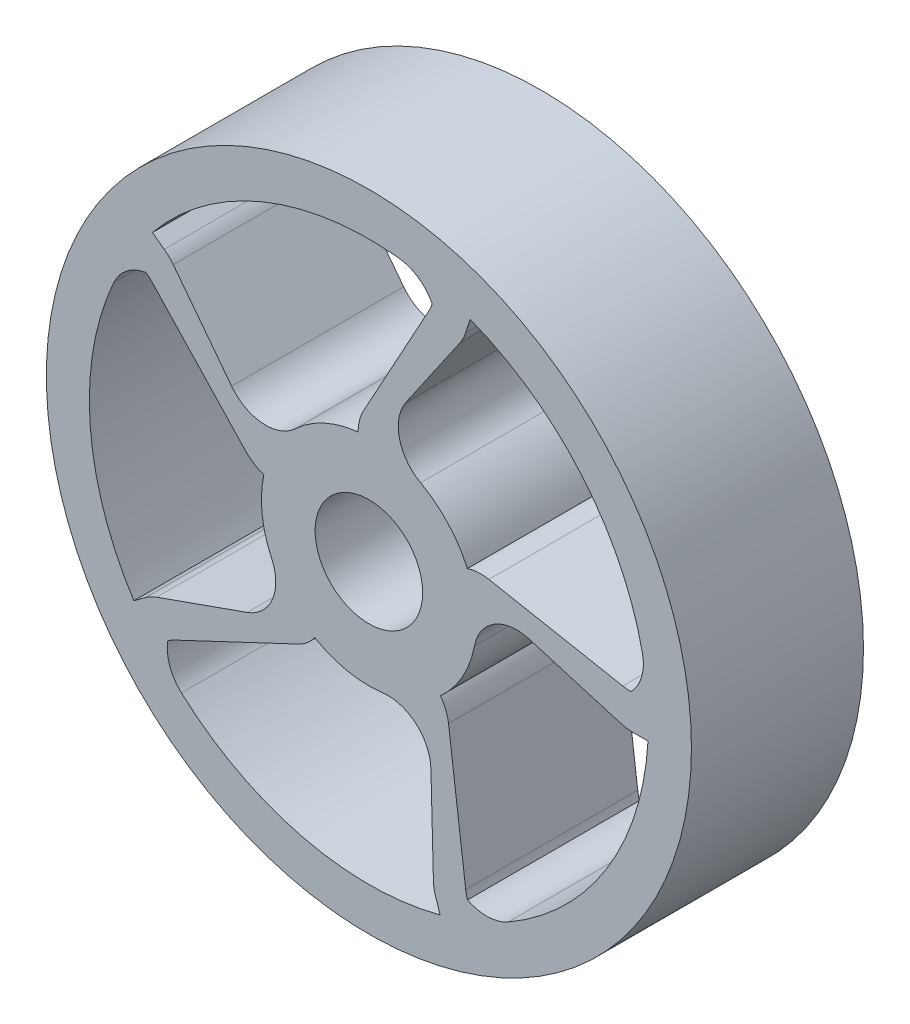
from build123d import *

# Parameters (mm, degrees)
SKETCH1_R           = 150
BOSS_EXTRUDE1_DEPTH = 80
BOSS_EXTRUDE2_DEPTH = 80
LOFT1_DEPTH         = 80
CIRPATTERN1_COUNT   = 5
FILLET1_R           = 20
FILLET2_R           = 20
FILLET3_R           = 20
SKETCH3_R           = 25
CUT_EXTRUDE1_DEPTH  = 80


with BuildPart() as part:
    # Sketch1 → Boss-Extrude1 (new body)
    with BuildSketch(Plane.XY):
        Circle(SKETCH1_R)
        with BuildLine():
            Line((129.710171657, 8.675907367), (119.956691368, 8.625091073))
            Line((119.956691368, 8.625091073), (120.040051321, -7.374691773))
            Line((120.040051321, -7.374691773), (129.793531611, -7.323875479))
            ThreePointArc((129.793531611, -7.323875479), (105.568888587, -75.86309882), (48.333925621, -120.680701166))
            Line((48.333925621, -120.680701166), (45.271605291, -111.420293279))
            Line((45.271605291, -111.420293279), (30.080667198, -116.443778112))
            Line((30.080667198, -116.443778112), (33.142987529, -125.704185999))
            ThreePointArc((33.142987529, -125.704185999), (-39.527513828, -123.84496619), (-99.838162814, -83.260682474))
            Line((-99.838162814, -83.260682474), (-91.977300573, -77.486619356))
            Line((-91.977300573, -77.486619356), (-101.449176589, -64.591520879))
            Line((-101.449176589, -64.591520879), (-109.310038829, -70.365583996))
            ThreePointArc((-109.310038829, -70.365583996), (-129.998235624, -0.677299621), (-110.037303615, 69.222769471))
            Line((-110.037303615, 69.222769471), (-102.116703238, 63.530928844))
            Line((-102.116703238, 63.530928844), (-92.779706461, 76.524022824))
            Line((-92.779706461, 76.524022824), (-100.700306837, 82.215863451))
            ThreePointArc((-100.700306837, 82.215863451), (-40.815814265, 123.426372003), (31.831369149, 126.042706802))
            Line((31.831369149, 126.042706802), (28.865707153, 116.750892719))
            Line((28.865707153, 116.750892719), (44.10816453, 111.88596794))
            Line((44.10816453, 111.88596794), (47.073826527, 121.177782024))
            ThreePointArc((47.073826527, 121.177782024), (104.772675129, 76.958992627), (129.710171657, 8.675907367))
        make_face(mode=Mode.SUBTRACT)
    extrude(amount=BOSS_EXTRUDE1_DEPTH)


with BuildPart() as body_2:
    # Sketch2 → Boss-Extrude2 (new body)
    with BuildSketch(Plane.XY):
        with BuildLine():
            Line((-5, 55), (5, 55))
            Line((5, 55), (5, 49.749371855))
            ThreePointArc((5, 49.749371855), (29.389262615, 40.450849719), (45.769379313, 20.128683944))
            Line((45.769379313, 20.128683944), (50.763023424, 21.751217272))
            Line((50.763023424, 21.751217272), (53.853193368, 12.240652109))
            Line((53.853193368, 12.240652109), (48.859549256, 10.618118781))
            ThreePointArc((48.859549256, 10.618118781), (47.552825815, -15.450849719), (33.287032059, -37.309161029))
            Line((33.287032059, -37.309161029), (36.373273848, -41.557008429))
            Line((36.373273848, -41.557008429), (28.283103904, -47.434860952))
            Line((28.283103904, -47.434860952), (25.196862116, -43.187013552))
            ThreePointArc((25.196862116, -43.187013552), (0, -50), (-25.196862116, -43.187013552))
            Line((-25.196862116, -43.187013552), (-28.283103904, -47.434860952))
            Line((-28.283103904, -47.434860952), (-36.373273848, -41.557008429))
            Line((-36.373273848, -41.557008429), (-33.287032059, -37.309161029))
            ThreePointArc((-33.287032059, -37.309161029), (-47.552825815, -15.450849719), (-48.859549256, 10.618118781))
            Line((-48.859549256, 10.618118781), (-53.853193368, 12.240652109))
            Line((-53.853193368, 12.240652109), (-50.763023424, 21.751217272))
            Line((-50.763023424, 21.751217272), (-45.769379313, 20.128683944))
            ThreePointArc((-45.769379313, 20.128683944), (-29.389262615, 40.450849719), (-5, 49.749371855))
            Line((-5, 49.749371855), (-5, 55))
        make_face()
    extrude(amount=BOSS_EXTRUDE2_DEPTH)


with BuildPart() as body_3:
    # Loft1: read off the stored shape, not the designer's step
    # Loft1 outline → Loft1 (new body)
    with BuildSketch(Plane.XY):
        Polygon((44.10816453, 111.88596794), (28.865707153, 116.750892719), (-5, 55), (5, 55), align=None)
    extrude(amount=LOFT1_DEPTH)


with BuildPart() as cirpattern1_1:
    # CirPattern1: pattern copy
    add(body_3.part.rotate(Axis((0, 0, 0), (0, 0, 1)), 1 * 360 / CIRPATTERN1_COUNT))


with BuildPart() as cirpattern1_2:
    # CirPattern1: pattern copy
    add(body_3.part.rotate(Axis((0, 0, 0), (0, 0, 1)), 2 * 360 / CIRPATTERN1_COUNT))


with BuildPart() as cirpattern1_3:
    # CirPattern1: pattern copy
    add(body_3.part.rotate(Axis((0, 0, 0), (0, 0, 1)), 3 * 360 / CIRPATTERN1_COUNT))


with BuildPart() as cirpattern1_4:
    # CirPattern1: pattern copy
    add(body_3.part.rotate(Axis((0, 0, 0), (0, 0, 1)), 4 * 360 / CIRPATTERN1_COUNT))

    # Combine1: union body 2, part, body 3, CirPattern1_1, CirPattern1_2, CirPattern1_3
    add(body_2.part)
    add(part.part)
    add(body_3.part)
    add(cirpattern1_1.part)
    add(cirpattern1_2.part)
    add(cirpattern1_3.part)

    # Fillet1
    # the kernel refuses this fillet: 20 mm, written as the material it adds along each edge
    with BuildSketch(Plane(origin=(-91.977300573, -77.486619356, 0), x_dir=(-0.8059436548419507, -0.5919922509796886, 0), z_dir=(0, 0, 1)), Plane(origin=(45.271605291, -111.420293279, 0), x_dir=(0.31396780203564834, -0.9494336307951725, 0), z_dir=(0, 0, 1)), Plane(origin=(-102.116703238, 63.530928844, 0), x_dir=(-0.8120683737452884, 0.5835622986131666, 0), z_dir=(0, 0, 1))) as fillet1_piece_1:
        with BuildLine():
            CenterArc((FILLET1_R * 0.0966409957188, FILLET1_R), FILLET1_R, 258.96004162, 11.03995838)
            Line((-FILLET1_R * 0.0948525451909, FILLET1_R * 0.0185061264634), (0, 0))
            Line((0, 0), (FILLET1_R * 0.0966409957188, 0))
        make_face()
    extrude(amount=80)
    with BuildSketch(Plane(origin=(119.956691369, 8.625091073, 0), x_dir=(-0.9824782333673042, 0.1863773617139722, 0), z_dir=(0, 0, 1))) as fillet1_piece_2:
        with BuildLine():
            CenterArc((FILLET1_R * 0.0966409957054, -FILLET1_R), FILLET1_R, 90, 11.03995838)
            Line((-FILLET1_R * 0.0948525452044, -FILLET1_R * 0.0185061264634), (0, 0))
            Line((0, 0), (FILLET1_R * 0.0966409957054, 0))
        make_face()
    extrude(amount=80)
    with BuildSketch(Plane(origin=(28.865707153, 116.750892719, 0), x_dir=(-0.4808578750966385, -0.8767985538067142, 0), z_dir=(0, 0, 1))) as fillet1_piece_3:
        with BuildLine():
            CenterArc((FILLET1_R * 0.0966409957188, -FILLET1_R), FILLET1_R, 90.000000002, 11.03995838)
            Line((-FILLET1_R * 0.0948525452298, -FILLET1_R * 0.018506126471), (0, 0))
            Line((0, 0), (FILLET1_R * 0.0966409956792, 0))
        make_face()
    extrude(amount=80)
    with BuildSketch(Plane(origin=(-36.373273848, -41.557008429, 0), x_dir=(-0.9426873980194184, -0.33367719372977617, 0), z_dir=(0, 0, 1)), Plane(origin=(28.283103904, -47.434860952, 0), x_dir=(0.026039443064681988, -0.9996609162135335, 0), z_dir=(0, 0, 1)), Plane(origin=(53.853193368, 12.240652109, 0), x_dir=(0.9587806588816111, -0.28414722971470946, 0), z_dir=(0, 0, 1)), Plane(origin=(5, 55, 0), x_dir=(0.5665195918801321, 0.8240482704404934, 0), z_dir=(0, 0, 1)), Plane(origin=(-50.763023424, 21.751217272, 0), x_dir=(-0.6086522958068845, 0.7934370692178484, 0), z_dir=(0, 0, 1))) as fillet1_piece_4:
        with BuildLine():
            CenterArc((6.167760881, -20), FILLET1_R, 90, 31.649839664)
            Line((-4.326771041, -2.974583714), (0, 0))
            Line((0, 0), (6.167760881, 0))
        make_face()
    extrude(amount=80)
    # the kernel refuses this fillet: 20 mm, written as the material it takes off along each edge
    with BuildSketch(Plane(origin=(-101.449176589, -64.591520879, -7.386208111), x_dir=(0.9426873980435565, 0.33367719366158266, 0), z_dir=(0, 0, 1)), Plane(origin=(30.080667198, -116.443778112, -7.386208111), x_dir=(-0.026039442992376174, 0.9996609162154169, 0), z_dir=(0, 0, 1)), Plane(origin=(44.10816453, 111.88596794, -7.386208111), x_dir=(-0.566519591939725, -0.8240482703995243, 0), z_dir=(0, 0, 1)), Plane(origin=(-92.779706461, 76.524022824, -7.386208111), x_dir=(0.6086522957494933, -0.7934370692618736, 0), z_dir=(0, 0, 1))) as fillet1_2_piece_1:
        with BuildLine():
            CenterArc((FILLET1_R * 0.147724162219, -FILLET1_R), FILLET1_R, 90.000000004, 16.806393351)
            Line((-FILLET1_R * 0.141414455522, -FILLET1_R * 0.042712760071), (0, 0))
            Line((0, 0), (FILLET1_R * 0.147724162147, 0))
        make_face()
    extrude(amount=94.772416222, mode=Mode.SUBTRACT)
    with BuildSketch(Plane(origin=(120.040051322, -7.374691773, -7.38620811), x_dir=(-0.9587806588816119, 0.2841472297147065, 0), z_dir=(0, 0, 1))) as fillet1_2_piece_2:
        with BuildLine():
            CenterArc((FILLET1_R * 0.14772416216, -FILLET1_R), FILLET1_R, 90, 16.806393351)
            Line((-FILLET1_R * 0.141414455511, -FILLET1_R * 0.04271276005), (0, 0))
            Line((0, 0), (FILLET1_R * 0.14772416216, 0))
        make_face()
    extrude(amount=94.77241622, mode=Mode.SUBTRACT)
    with BuildSketch(Plane(origin=(-28.283103904, -47.434860952, -12.810588384), x_dir=(-0.9043914519746539, -0.426703763277496, 0), z_dir=(0, 0, 1)), Plane(origin=(36.373273848, -41.557008429, -12.810588384), x_dir=(0.12634706636512016, -0.9919860980986216, 0), z_dir=(0, 0, 1)), Plane(origin=(50.763023424, 21.751217272, -12.810588384), x_dir=(0.9824782333673043, -0.18637736171397165, 0), z_dir=(0, 0, 1)), Plane(origin=(-53.853193368, 12.240652109, -12.810588384), x_dir=(-0.6852917228203294, 0.7282686692656392, 0), z_dir=(0, 0, 1))) as fillet1_2_piece_3:
        with BuildLine():
            CenterArc((FILLET1_R * 0.256211767685, -FILLET1_R), FILLET1_R, 90, 28.741446185)
            Line((-FILLET1_R * 0.224646107378, -FILLET1_R * 0.123201446175), (0, 0))
            Line((0, 0), (FILLET1_R * 0.256211767684, 0))
        make_face()
    extrude(amount=105.621176768, mode=Mode.SUBTRACT)
    with BuildSketch(Plane(origin=(-5, 55, -12.810588384), x_dir=(0, -1, 0), z_dir=(0, 0, 1))) as fillet1_2_piece_4:
        with BuildLine():
            CenterArc((FILLET1_R * 0.256211767684, FILLET1_R), FILLET1_R, 241.258553815, 28.741446185)
            Line((-FILLET1_R * 0.224646107378, FILLET1_R * 0.123201446174), (0, 0))
            Line((0, 0), (FILLET1_R * 0.256211767684, 0))
        make_face()
    extrude(amount=105.621176768, mode=Mode.SUBTRACT)

    # Fillet2
    fillet2_edges = [cirpattern1_4.edges().sort_by_distance(p)[0] for p in [
        (-45.769379313, 20.128683944, 40),
        (5, 49.749371855, 40),
        (48.859549256, 10.618118781, 40),
        (25.196862116, -43.187013552, 40),
        (-33.287032059, -37.309161029, 40),
    ]]
    fillet(fillet2_edges, radius=FILLET2_R - 0.0001)  # a hair under: the kernel refuses the full size

    # Fillet3
    # the kernel refuses this fillet: 20 mm, written as the material it adds along each edge
    with BuildSketch(Plane(origin=(-99.838162814, -83.260682474, 0), x_dir=(0.6928923413155604, -0.7210410552432093, 0), z_dir=(0, 0, 1)), Plane(origin=(48.333925621, -120.680701166, 0), x_dir=(0.899866302844142, 0.43616583658697394, 0), z_dir=(0, 0, 1)), Plane(origin=(129.710171657, 8.675907367, 0), x_dir=(-0.1367443808271708, 0.9906063669854912, 0), z_dir=(0, 0, 1)), Plane(origin=(31.831369149, 126.042706802, 0), x_dir=(-0.9843789779658949, 0.17606256768211787, 0), z_dir=(0, 0, 1)), Plane(origin=(-110.037303615, 69.222769471, 0), x_dir=(-0.4716352853666361, -0.881793716011365, 0), z_dir=(0, 0, 1))) as fillet3_piece_1:
        with BuildLine():
            CenterArc((16.878882523, 19.95047746), FILLET3_R, 217.581129198, 56.451736362)
            Line((1.029071396, 7.752793776), (0.712075174, 7.508840102))
            ThreePointArc((0.712075174, 7.508840102), (0.118013554, 3.929029475), (-0.396522144, 0.052632587))
            Line((-0.396522144, 0.052632587), (-0.028131471, -0.399009549))
            ThreePointArc((-0.028131471, -0.399009549), (9.142728033, -0.721896513), (18.313587537, -0.399009549))
            Line((18.313587537, -0.399009549), (18.285456067, 0))
        make_face()
    extrude(amount=80)

    # Sketch3 → Cut-Extrude1 (cut)
    with BuildSketch(Plane.XY.offset(80)):
        Circle(SKETCH3_R)
    extrude(amount=-CUT_EXTRUDE1_DEPTH, mode=Mode.SUBTRACT)


solid = cirpattern1_4.part
